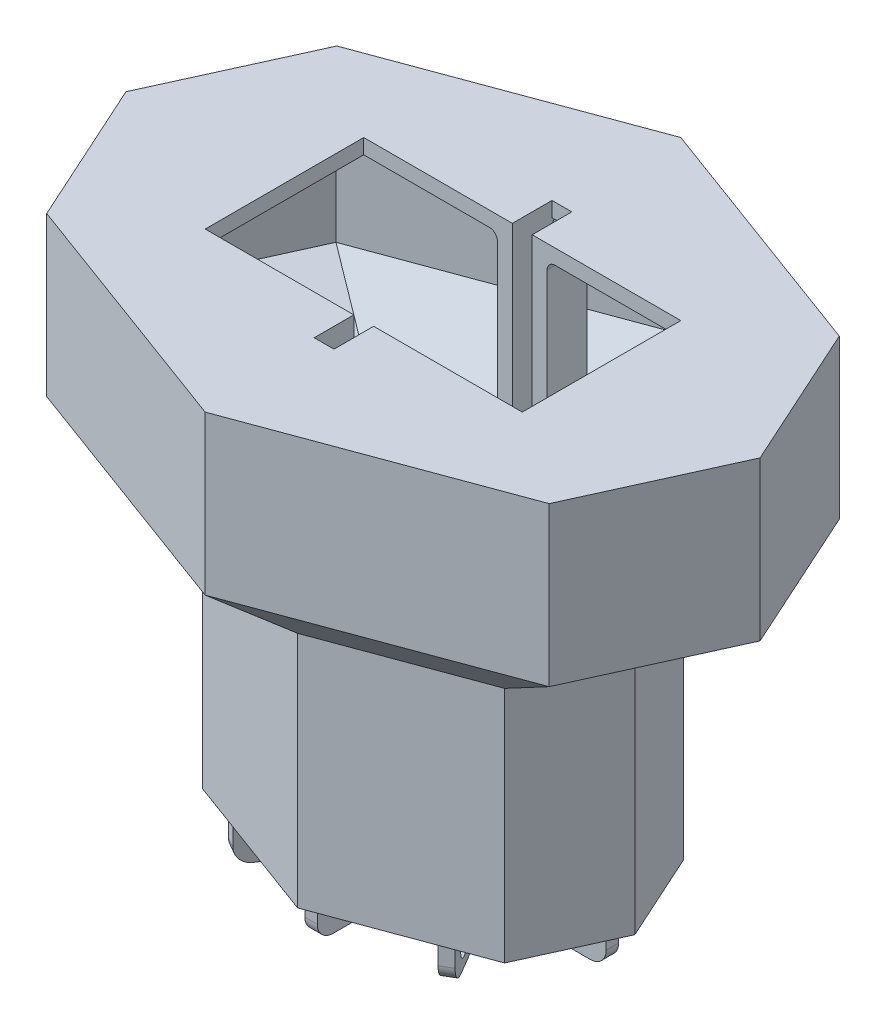
from build123d import *

# Parameters (mm, degrees)
BOSS_EXTRUDE1_DEPTH     = 25.4
CUT_EXTRUDE2_DEPTH      = 22.999999974
BOSS_EXTRUDE2_DEPTH     = 35.7
BOSS_EXTRUDE3_DEPTH     = 2.4
CUT_EXTRUDE3_DEPTH      = 2.400000026
SKETCH15_W              = 2.4
SKETCH15_H              = 6.35
BOSS_EXTRUDE4_DEPTH     = 38.1
SKETCH17_W              = 2.4
SKETCH17_H              = 6.35
FILLET1_R               = 1.27
SKETCH22_W              = 8
SKETCH22_H              = 2
BOSS_EXTRUDE6_DEPTH     = 6
CUT_EXTRUDE4_REACH      = 106.241
SKETCH23_R              = 1.5
FILLET2_R               = 2.54
CRVPATTERN1_START       = -1
CRVPATTERN1_OUTLINE_R   = 1.5
CRVPATTERN1_DEPTH       = 2
CRVPATTERN1_START_2     = -8.351942283
CRVPATTERN1_2_OUTLINE_R = 1.5
CRVPATTERN1_2_DEPTH     = 2
CRVPATTERN1_START_3     = 5.275828871
CRVPATTERN1_3_OUTLINE_R = 1.5
CRVPATTERN1_3_DEPTH     = 2
CRVPATTERN1_START_4     = -1.623155819
CRVPATTERN1_4_OUTLINE_R = 1.5
CRVPATTERN1_4_DEPTH     = 2
CRVPATTERN1_5_OUTLINE_R = 1.5
CRVPATTERN1_5_DEPTH     = 2
CRVPATTERN1_6_OUTLINE_R = 1.5
CRVPATTERN1_6_DEPTH     = 2


with BuildPart() as part:
    # Sketch1 → Boss-Extrude1 (new body)
    with BuildSketch(Plane(origin=(0, 0, 0), x_dir=(1, 0, 0), z_dir=(0, 1, 0))):
        Polygon((-40.254215437, 23.240782119), (-50.8, 0), (-40.254215437, -23.240782119), (0, -38.1), (40.254215437, -23.240782119), (50.8, 0), (40.254215437, 23.240782119), (0, 38.1), align=None)
    extrude(amount=-BOSS_EXTRUDE1_DEPTH)

    # Sketch4 → Cut-Extrude2 (cut)
    with BuildSketch(Plane(origin=(0, -2.400000026, 0), x_dir=(1, 0, 0), z_dir=(0, 1, 0))):
        Polygon((-38.482844664, 21.336363897), (-48.164476541, 0), (-38.482844664, -21.336363897), (0, -35.541707793), (38.482844664, -21.336363897), (48.164476541, 0), (38.482844664, 21.336363897), (0, 35.541707793), align=None)
    extrude(amount=-CUT_EXTRUDE2_DEPTH, mode=Mode.SUBTRACT)



with BuildPart() as body_2:
    # Sketch6 → Boss-Extrude2 (new body)
    with BuildSketch(Plane(origin=(0, -38.1, 0), x_dir=(-1, 0, 0), z_dir=(0, -1, 0))):
        Polygon((0, 23.290943239), (-24.219684, 14.350623383), (-30.731452053, 0), (-24.219684, -14.350623383), (0, -23.290943239), (24.219684, -14.350623383), (30.731452053, 0), (24.219684, 14.350623383), align=None)
        Polygon((0, 20.732651032), (-22.448313226, 12.446205161), (-28.095928594, 0), (-22.448313226, -12.446205161), (0, -20.732651032), (22.448313226, -12.446205161), (28.095928594, 0), (22.448313226, 12.446205161), align=None, mode=Mode.SUBTRACT)
    extrude(amount=BOSS_EXTRUDE2_DEPTH)


with BuildPart() as part_1:
    add(part.part)

    add(body_2.part)  # Loft2 merges body 2
    # Sketch12 → Loft2 section 0
    with BuildSketch(Plane.XZ.offset(25.4)):
        with BuildLine():
            Line((50.8, 0), (40.254215437, -23.240782119))
            Line((40.254215437, -23.240782119), (0, -38.1))
            Line((0, -38.1), (-40.254215437, -23.240782119))
            Line((-40.254215437, -23.240782119), (-50.8, 0))
            Line((-50.8, 0), (-40.254215437, 23.240782119))
            Line((-40.254215437, 23.240782119), (0, 38.1))
            Line((0, 38.1), (40.254215437, 23.240782119))
            Line((40.254215437, 23.240782119), (50.8, 0))
        make_face()
    # Sketch9 → Loft2 section 1
    with BuildSketch(Plane(origin=(0, -38.1, 0), x_dir=(1, 0, 0), z_dir=(0, 1, 0))):
        with BuildLine():
            Line((0, -23.290943239), (-24.219684, -14.350623383))
            Line((-24.219684, -14.350623383), (-30.731452053, 0))
            Line((-30.731452053, 0), (-24.219684, 14.350623383))
            Line((-24.219684, 14.350623383), (0, 23.290943239))
            Line((0, 23.290943239), (24.219684, 14.350623383))
            Line((24.219684, 14.350623383), (30.731452053, 0))
            Line((30.731452053, 0), (24.219684, -14.350623383))
            Line((24.219684, -14.350623383), (0, -23.290943239))
        make_face()
    loft()

    # Cut-Loft2: read off the stored shape, not the designer's step
    # Cut-Loft2: loft between two sections, ruled curve by curve
    cut_loft2_from = [
        Edge.make_line((0, -25.4, 35.541707793), (-38.482844664, -25.4, 21.336363897)),
        Edge.make_line((38.482844664, -25.4, 21.336363897), (0, -25.4, 35.541707793)),
        Edge.make_line((48.164476541, -25.4, 0), (38.482844664, -25.4, 21.336363897)),
        Edge.make_line((38.482844664, -25.4, -21.336363897), (48.164476541, -25.4, 0)),
        Edge.make_line((0, -25.4, -35.541707793), (38.482844664, -25.4, -21.336363897)),
        Edge.make_line((-38.482844664, -25.4, -21.336363897), (0, -25.4, -35.541707793)),
        Edge.make_line((-48.164476541, -25.4, 0), (-38.482844664, -25.4, -21.336363897)),
        Edge.make_line((-38.482844664, -25.4, 21.336363897), (-48.164476541, -25.4, 0)),
    ]
    cut_loft2_to = [
        Edge.make_line((0, -38.1, 20.732651032), (-22.448313226, -38.1, 12.446205161)),
        Edge.make_line((22.448313226, -38.1, 12.446205161), (0, -38.1, 20.732651032)),
        Edge.make_line((28.095928594, -38.1, 0), (22.448313226, -38.1, 12.446205161)),
        Edge.make_line((22.448313226, -38.1, -12.446205161), (28.095928594, -38.1, 0)),
        Edge.make_line((0, -38.1, -20.732651032), (22.448313226, -38.1, -12.446205161)),
        Edge.make_line((-22.448313226, -38.1, -12.446205161), (0, -38.1, -20.732651032)),
        Edge.make_line((-28.095928594, -38.1, 0), (-22.448313226, -38.1, -12.446205161)),
        Edge.make_line((-22.448313226, -38.1, 12.446205161), (-28.095928594, -38.1, 0)),
    ]
    cut_loft2 = Solid(Shell([*[Face.make_surface_from_curves(cut_loft2_from[k], cut_loft2_to[k]) for k in range(8)], Face(Wire(cut_loft2_from)), Face(Wire(cut_loft2_to))]))
    add(cut_loft2, mode=Mode.SUBTRACT)

    # Sketch13 → Boss-Extrude3 (add)
    with BuildSketch(Plane.XZ.offset(73.8)):
        Polygon((0, -23.290943239), (24.219684, -14.350623383), (30.731452053, 0), (24.219684, 14.350623383), (0, 23.290943239), (-24.219684, 14.350623383), (-30.731452053, 0), (-24.219684, -14.350623383), align=None)
    extrude(amount=BOSS_EXTRUDE3_DEPTH)

    # Sketch14 → Cut-Extrude3 (cut)
    with BuildSketch(Plane(origin=(0, 0, 0), x_dir=(1, 0, 0), z_dir=(0, 1, 0))):
        Polygon((-25.4, -12.7), (-1.5875, -12.7), (-1.5875, -19.05), (1.5875, -19.05), (1.5875, -12.7), (25.4, -12.7), (25.4, 12.7), (1.5875, 12.7), (1.5875, 19.05), (-1.5875, 19.05), (-1.5875, 12.7), (-25.4, 12.7), align=None)
    extrude(amount=-CUT_EXTRUDE3_DEPTH, mode=Mode.SUBTRACT)

    # Sketch15 → Boss-Extrude4 (add)
    with BuildSketch(Plane.XZ.offset(2.400000026)):
        with Locations((-2.7875, 15.875)):
            Rectangle(SKETCH15_W, SKETCH15_H)
        with Locations((2.7875, 15.875)):
            Rectangle(SKETCH15_W, SKETCH15_H)
    boss_extrude4 = extrude(amount=BOSS_EXTRUDE4_DEPTH)

    # Sweep1: sweep along a path in Sketch16
    with BuildLine(Plane(origin=(0, 0, 15.875), x_dir=(-1, 0, 0), z_dir=(0, 0, -1))) as sweep1_path:
        ThreePointArc((2.7875, -40.500000026), (0, -43.287500026), (-2.7875, -40.500000026))
    # Sketch17 → Sweep1 (sweep)
    with BuildSketch(Plane.XZ.offset(40.500000026)):
        with Locations((2.7875, 15.875)):
            Rectangle(SKETCH17_W, SKETCH17_H)
    sweep1 = sweep(path=sweep1_path.line)

    # Mirror1: Boss-Extrude4, Sweep1 across plane
    add(boss_extrude4.mirror(Plane.XY))
    add(sweep1.mirror(Plane.XY))

    # Fillet1
    fillet1_edges = [part_1.edges().sort_by_distance(p)[0] for p in [
        (-2.7875, -2.400000026, 19.05),
        (-3.9875, -2.400000026, 15.875),
        (2.7875, -2.400000026, 19.05),
        (3.9875, -2.400000026, 15.875),
        (-2.7875, -2.400000026, -19.05),
        (-3.9875, -2.400000026, -15.875),
        (2.7875, -2.400000026, -19.05),
        (3.9875, -2.400000026, -15.875),
    ]]
    fillet(fillet1_edges, radius=FILLET1_R)

    # Sketch22 → Boss-Extrude6 (add)
    with BuildSketch(Plane.XZ.offset(76.2)):
        with Locations((-24.381452053, 0)):
            Rectangle(SKETCH22_W, SKETCH22_H)
    extrude(amount=BOSS_EXTRUDE6_DEPTH)

    # Sketch23 → Cut-Extrude4 (cut, up to next)
    with BuildSketch(Plane.XY.offset(1), mode=Mode.PRIVATE) as cut_extrude4_sk1:
        with Locations((-24.381452053, -79.2)):
            Circle(SKETCH23_R)
    cut_extrude4_tool1 = extrude(cut_extrude4_sk1.sketch, amount=-CUT_EXTRUDE4_REACH, mode=Mode.PRIVATE) & part_1.part
    add(cut_extrude4_tool1.solids().sort_by_distance((-24.381452, -79.2, 1))[0], mode=Mode.SUBTRACT)

    # Fillet2
    fillet2_edges = [part_1.edges().sort_by_distance(p)[0] for p in [
        (-28.381452053, -82.2, 0),
        (-20.381452053, -82.2, 0),
    ]]
    fillet(fillet2_edges, radius=FILLET2_R)

    # CrvPattern1: read off the stored shape, not the designer's step
    # CrvPattern1 outline → CrvPattern1 (add)
    with BuildSketch(Plane.XY.offset(CRVPATTERN1_START)):
        with BuildLine():
            ThreePointArc((19.135140415, -79.66), (19.87908919, -81.456051225), (21.675140415, -82.2))
            Line((21.675140415, -82.2), (24.595140415, -82.2))
            ThreePointArc((24.595140415, -82.2), (26.391191639, -81.456051224), (27.135140415, -79.66))
            Line((27.135140415, -79.66), (27.135140415, -76.2))
            Line((27.135140415, -76.2), (19.135140415, -76.2))
            Line((19.135140415, -76.2), (19.135140415, -79.66))
        make_face()
        with Locations((23.135140415, -79.2)):
            Circle(CRVPATTERN1_OUTLINE_R, mode=Mode.SUBTRACT)
    extrude(amount=CRVPATTERN1_DEPTH)

    # CrvPattern1 2 outline → CrvPattern1 2 (add)
    with BuildSketch(Plane(origin=(0, 0, 0), x_dir=(0.504454171814361, 0, 0.8634384682993266), z_dir=(0.8634384682993265, 0, -0.5044541718143614)).offset(CRVPATTERN1_START_2)):
        with BuildLine():
            ThreePointArc((-14.946416582, 79.66), (-15.690365358, 81.456051224), (-17.486416582, 82.2))
            Line((-17.486416582, 82.2), (-20.406416582, 82.2))
            ThreePointArc((-20.406416582, 82.2), (-22.202467806, 81.456051224), (-22.946416582, 79.66))
            Line((-22.946416582, 79.66), (-22.946416582, 76.2))
            Line((-22.946416582, 76.2), (-14.946416582, 76.2))
            Line((-14.946416582, 76.2), (-14.946416582, 79.66))
        make_face()
        with Locations((-18.946416582, 79.2)):
            Circle(CRVPATTERN1_2_OUTLINE_R, mode=Mode.SUBTRACT)
    extrude(amount=CRVPATTERN1_2_DEPTH)

    # CrvPattern1 3 outline → CrvPattern1 3 (add)
    with BuildSketch(Plane(origin=(0, 0, 0), x_dir=(0.504454171814361, 0, 0.8634384682993266), z_dir=(0.8634384682993265, 0, -0.5044541718143614)).offset(CRVPATTERN1_START_3)):
        with BuildLine():
            Line((14.317709477, 79.66), (14.317709477, 76.2))
            Line((14.317709477, 76.2), (22.317709477, 76.2))
            Line((22.317709477, 76.2), (22.317709477, 79.66))
            ThreePointArc((22.317709477, 79.66), (21.573760701, 81.456051224), (19.777709477, 82.2))
            Line((19.777709477, 82.2), (16.857709477, 82.2))
            ThreePointArc((16.857709477, 82.2), (15.061658252, 81.456051225), (14.317709477, 79.66))
        make_face()
        with Locations((18.317709477, 79.2)):
            Circle(CRVPATTERN1_3_OUTLINE_R, mode=Mode.SUBTRACT)
    extrude(amount=CRVPATTERN1_3_DEPTH)

    # CrvPattern1 4 outline → CrvPattern1 4 (add)
    # profile 1 of 2: a face of its own
    with BuildSketch(Plane.YZ.offset(CRVPATTERN1_START_4)):
        with BuildLine():
            ThreePointArc((-79.66, -12.522128441), (-81.456051224, -13.266077217), (-82.2, -15.062128441))
            Line((-82.2, -15.062128441), (-82.2, -17.982128441))
            ThreePointArc((-82.2, -17.982128441), (-81.456051224, -19.778179665), (-79.66, -20.522128441))
            Line((-79.66, -20.522128441), (-76.2, -20.522128441))
            Line((-76.2, -20.522128441), (-76.2, -12.522128441))
            Line((-76.2, -12.522128441), (-79.66, -12.522128441))
        make_face()
        with Locations((-79.2, -16.522128441)):
            Circle(CRVPATTERN1_4_OUTLINE_R, mode=Mode.SUBTRACT)
    # profile 2 of 2: a face of its own
    with BuildSketch(Plane.YZ.offset(CRVPATTERN1_START_4)):
        with BuildLine():
            Line((-79.66, 12.522128441), (-76.2, 12.522128441))
            Line((-76.2, 12.522128441), (-76.2, 20.522128441))
            Line((-76.2, 20.522128441), (-79.66, 20.522128441))
            ThreePointArc((-79.66, 20.522128441), (-81.456051224, 19.778179665), (-82.2, 17.982128441))
            Line((-82.2, 17.982128441), (-82.2, 15.062128441))
            ThreePointArc((-82.2, 15.062128441), (-81.456051224, 13.266077217), (-79.66, 12.522128441))
        make_face()
        with Locations((-79.2, 16.522128441)):
            Circle(CRVPATTERN1_4_OUTLINE_R, mode=Mode.SUBTRACT)
    extrude(amount=CRVPATTERN1_4_DEPTH)

    # CrvPattern1 5 outline → CrvPattern1 5 (add)
    with BuildSketch(Plane(origin=(0, 0, 0), x_dir=(0.5044541718143608, 0, -0.8634384682993267), z_dir=(0.8634384682993267, 0, 0.5044541718143608)).offset(CRVPATTERN1_START_2)):
        with BuildLine():
            Line((-14.946416582, -79.66), (-14.946416582, -76.2))
            Line((-14.946416582, -76.2), (-22.946416582, -76.2))
            Line((-22.946416582, -76.2), (-22.946416582, -79.66))
            ThreePointArc((-22.946416582, -79.66), (-22.202467806, -81.456051224), (-20.406416582, -82.2))
            Line((-20.406416582, -82.2), (-17.486416582, -82.2))
            ThreePointArc((-17.486416582, -82.2), (-15.690365358, -81.456051224), (-14.946416582, -79.66))
        make_face()
        with Locations((-18.946416582, -79.2)):
            Circle(CRVPATTERN1_5_OUTLINE_R, mode=Mode.SUBTRACT)
    extrude(amount=CRVPATTERN1_5_DEPTH)

    # CrvPattern1 6 outline → CrvPattern1 6 (add)
    with BuildSketch(Plane(origin=(0, 0, 0), x_dir=(0.5044541718143608, 0, -0.8634384682993267), z_dir=(0.8634384682993267, 0, 0.5044541718143608)).offset(CRVPATTERN1_START_3)):
        with BuildLine():
            ThreePointArc((14.317709477, -79.66), (15.061658252, -81.456051225), (16.857709477, -82.2))
            Line((16.857709477, -82.2), (19.777709477, -82.2))
            ThreePointArc((19.777709477, -82.2), (21.573760701, -81.456051224), (22.317709477, -79.66))
            Line((22.317709477, -79.66), (22.317709477, -76.2))
            Line((22.317709477, -76.2), (14.317709477, -76.2))
            Line((14.317709477, -76.2), (14.317709477, -79.66))
        make_face()
        with Locations((18.317709477, -79.2)):
            Circle(CRVPATTERN1_6_OUTLINE_R, mode=Mode.SUBTRACT)
    extrude(amount=CRVPATTERN1_6_DEPTH)


solid = part_1.part
